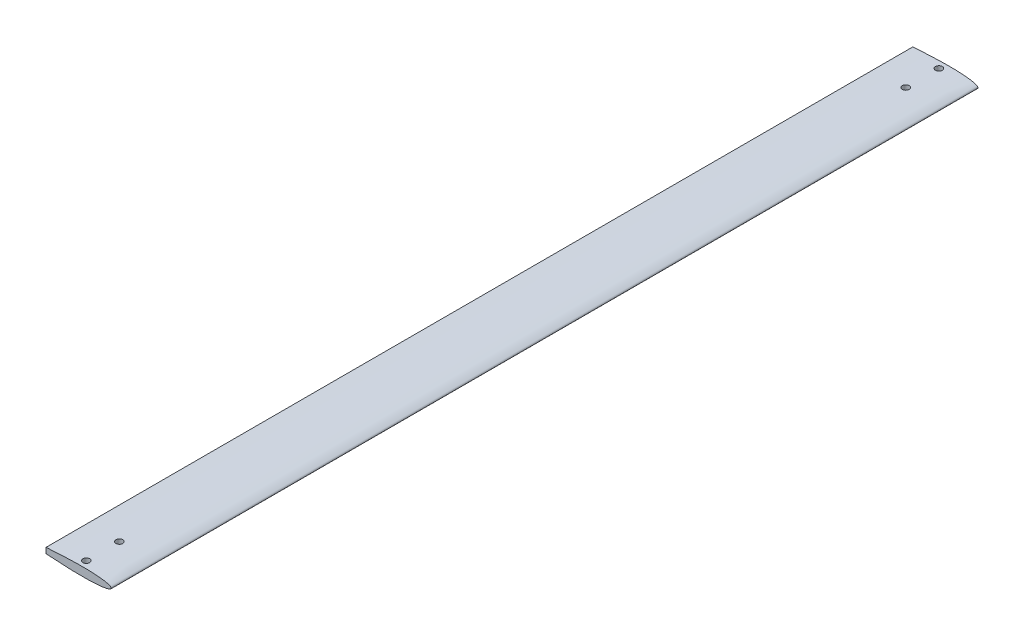
from build123d import *

# Parameters (mm, degrees)
BOSS_EXTRUDE1_DEPTH = 458.7
SKETCH2_R           = 3.6
CUT_EXTRUDE1_DEPTH  = 20


with BuildPart() as part:
    # Sketch1 → Boss-Extrude1 (new, symmetric)
    with BuildSketch(Plane.XY):
        with BuildLine():
            Line((-69.03632, 2.932563938), (-69.03632, -2.932563938))
            add(Edge.make_bspline(
                [(-69.03632, 2.932563938), (-68.173700508, 2.994245323), (-65.601050812, 3.178201979), (-61.27842582, 3.456757474), (-56.049780282, 3.765934941), (-50.763071482, 4.038473643), (-45.476317151, 4.266210174), (-40.247365046, 4.438790047), (-35.133467843, 4.547081177), (-30.190601827, 4.582982038), (-25.472869615, 4.540235957), (-21.0318871, 4.414934146), (-16.916225583, 4.205882172), (-13.170738785, 3.914915502), (-9.83627646, 3.546378804), (-6.948065805, 3.108237989), (-4.53763665, 2.607314402), (-2.622635472, 2.060824097), (-1.223550443, 1.460817264), (-0.291506392, 0.840934129), (0.120516717, 0), (-0.291506392, -0.840934129), (-1.223550443, -1.460817264), (-2.622635472, -2.060824097), (-4.53763665, -2.607314402), (-6.948065805, -3.108237989), (-9.83627646, -3.546378804), (-13.170738785, -3.914915502), (-16.916225583, -4.205882172), (-21.0318871, -4.414934146), (-25.472869615, -4.540235957), (-30.190601827, -4.582982038), (-35.133467843, -4.547081177), (-40.247365046, -4.438790047), (-45.476317151, -4.266210174), (-50.763071482, -4.038473643), (-56.049780282, -3.765934941), (-61.27842582, -3.456757474), (-65.601050812, -3.178201979), (-68.173700508, -2.994245323), (-69.03632, -2.932563938)],
                knots=[0, 0, 0, 0, 0.018499199, 0.055171439, 0.092655195, 0.130538861, 0.168407204, 0.205846372, 0.242448967, 0.277819055, 0.311576982, 0.343363918, 0.372846133, 0.39971914, 0.423712133, 0.444593591, 0.462180115, 0.476353861, 0.487105625, 0.494669113, 0.5, 0.505330887, 0.512894375, 0.523646139, 0.537819885, 0.555406409, 0.576287867, 0.60028086, 0.627153867, 0.656636082, 0.688423018, 0.722180945, 0.757551033, 0.794153628, 0.831592796, 0.869461139, 0.907344805, 0.944828561, 0.981500801, 1, 1, 1, 1], degree=3))
        make_face()
    extrude(amount=BOSS_EXTRUDE1_DEPTH, both=True)

    # Sketch2 → Cut-Extrude1 (cut)
    with BuildSketch(Plane(origin=(0, -10, 0), x_dir=(1, 0, 0), z_dir=(0, 1, 0))):
        with Locations((-33.9, -451.2)):
            Circle(SKETCH2_R)
        with Locations((-33.9, -416.2)):
            Circle(SKETCH2_R)
        with Locations((-33.9, 416.2)):
            Circle(SKETCH2_R)
        with Locations((-33.9, 451.2)):
            Circle(SKETCH2_R)
    extrude(amount=CUT_EXTRUDE1_DEPTH, mode=Mode.SUBTRACT)


solid = part.part
